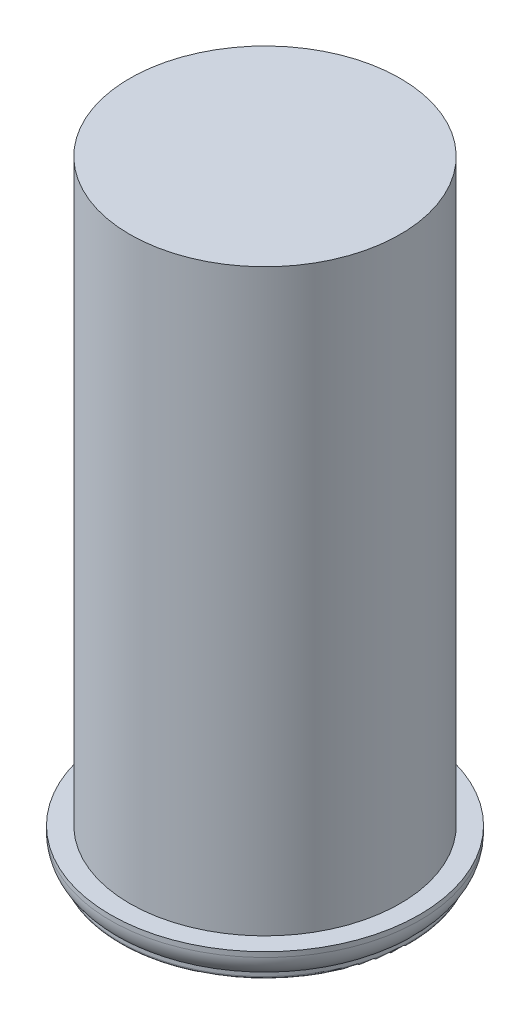
from build123d import *

# Parameters (mm, degrees)
SKETCH1_R           = 16
BOSS_EXTRUDE1_DEPTH = 2.54
SKETCH2_R           = 14
BOSS_EXTRUDE2_DEPTH = 60
SKETCH3_R           = 15
BOSS_EXTRUDE3_DEPTH = 2.54
DOME1_FACE_RADIUS   = 15
DOME1_HEIGHT        = 12.7
FILLET1_R           = 2.54
FILLET2_R           = 0.254


with BuildPart() as part:
    # Sketch1 → Boss-Extrude1 (new body)
    with BuildSketch(Plane(origin=(0, 0, 0), x_dir=(1, 0, 0), z_dir=(0, 1, 0))):
        with Locations(Location((0, 0, 0), (0, 0, 270))):
            Circle(SKETCH1_R)
    extrude(amount=BOSS_EXTRUDE1_DEPTH)

    # Sketch2 → Boss-Extrude2 (add)
    with BuildSketch(Plane(origin=(0, 2.54, 0), x_dir=(1, 0, 0), z_dir=(0, 1, 0))):
        with Locations(Location((0, 0, 0), (0, 0, 270))):
            Circle(SKETCH2_R)
    extrude(amount=BOSS_EXTRUDE2_DEPTH)

    # Sketch3 → Boss-Extrude3 (add)
    with BuildSketch(Plane.XZ):
        with Locations(Location((0, 0, 0), (0, 0, 90))):
            Circle(SKETCH3_R)
    extrude(amount=BOSS_EXTRUDE3_DEPTH)

    # Dome1: a dome of height H over a round flat face of radius A is a cap of a sphere of radius (A * A + H * H) / (2 * H)
    dome1_r = (DOME1_FACE_RADIUS * DOME1_FACE_RADIUS + DOME1_HEIGHT * DOME1_HEIGHT) / (2 * DOME1_HEIGHT)
    dome1_base = Plane((0, -2.54, 0), z_dir=(0, 1, 0))
    with Locations(dome1_base.offset(DOME1_HEIGHT - dome1_r)):
        dome1_ball = Sphere(dome1_r, mode=Mode.PRIVATE)
    add(split(dome1_ball, bisect_by=dome1_base, keep=Keep.TOP, mode=Mode.PRIVATE), mode=Mode.SUBTRACT)

    # Fillet1
    # the kernel refuses this fillet: 2.54 mm, written as the material it takes off along each edge
    with BuildSketch(Plane(origin=(0, 0, 0), x_dir=(0, 0, 1), z_dir=(-1, 0, 0))) as fillet1_piece_1:
        with BuildLine():
            CenterArc((13.46, 2.019900988), FILLET1_R, 307.322390296, 52.677609704)
            Line((15, 0), (15.0308, -0.04039802))
            ThreePointArc((15.0308, -0.04039802), (15.5, -0.0508), (16, -0.0508))
            Line((16, -0.0508), (16.0508, 0))
            Line((16.0508, 0), (16.0508, 2.019900988))
            Line((16.0508, 2.019900988), (16, 2.019900988))
        make_face()
    revolve(axis=Axis((0, 0, 0), (0, 1, 0)), mode=Mode.SUBTRACT)

    # Fillet2
    fillet2_edges = [part.edges().sort_by_distance(p)[0] for p in [
        (0, -2.54, -15),
    ]]
    fillet(fillet2_edges, radius=FILLET2_R)


solid = part.part
